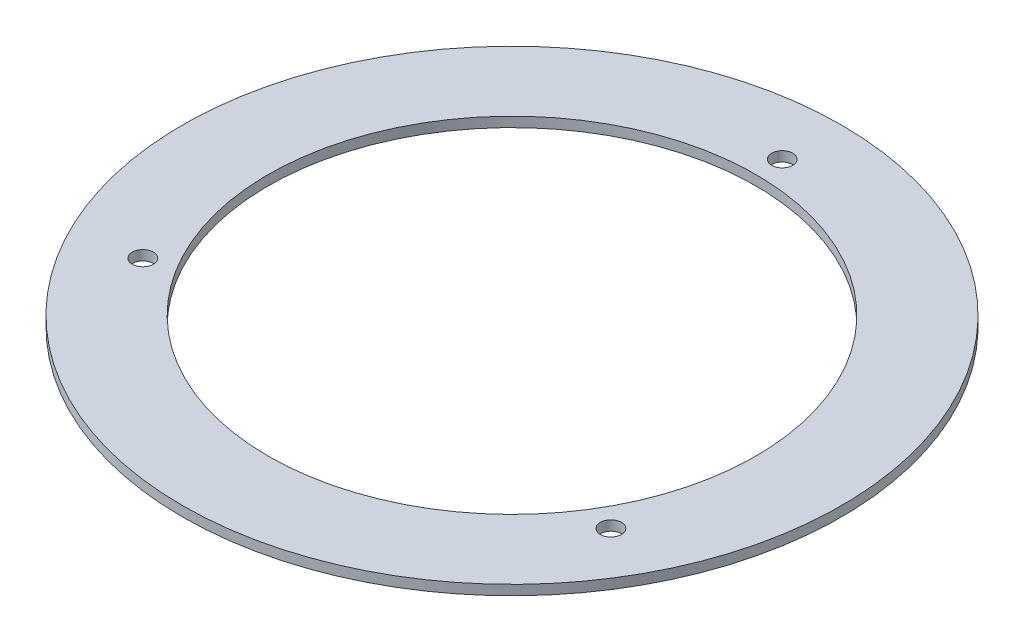
from build123d import *

# Parameters (mm, degrees)
SKETCH1_R          = 50
SKETCH1_R_2        = 37
BASE_FLANGE1_DEPTH = 1.5
SKETCH6_R          = 1.6
CUT_EXTRUDE1_DEPTH = 71.726586232


# Sheet-metal steps are written as plain solids
with BuildPart() as part:
    # Sketch1 → Base-Flange1 (new body)
    with BuildSketch(Plane(origin=(0, 0, 0), x_dir=(1, 0, 0), z_dir=(0, 1, 0))):
        with Locations(Location((0, 0, 0), (0, 0, 270))):
            Circle(SKETCH1_R)
        with Locations(Location((0, 0, 0), (0, 0, 270))):
            Circle(SKETCH1_R_2, mode=Mode.SUBTRACT)
    extrude(amount=-BASE_FLANGE1_DEPTH)

    # Sketch6 → Cut-Extrude1 (cut, through all)
    with BuildSketch(Plane(origin=(0, 0, 0), x_dir=(1, 0, 0), z_dir=(0, 1, 0))):
        with Locations(Location((0, 41, 0), (0, 0, 270))):
            Circle(SKETCH6_R)
        with Locations(Location((35.507041555, -20.5, 0), (0, 0, 270))):
            Circle(SKETCH6_R)
        with Locations(Location((-35.507041555, -20.5, 0), (0, 0, 270))):
            Circle(SKETCH6_R)
    extrude(amount=-CUT_EXTRUDE1_DEPTH, mode=Mode.SUBTRACT)


solid = part.part
